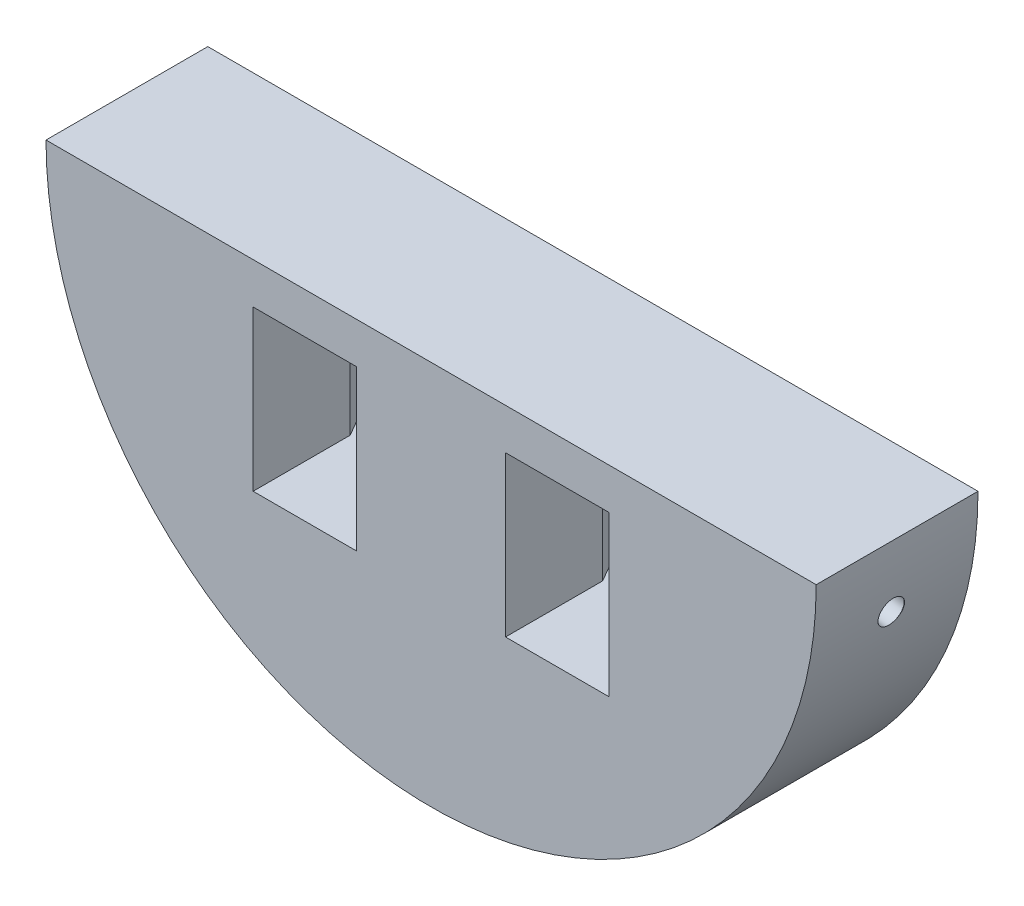
from build123d import *
from OCP.BRepFilletAPI import BRepFilletAPI_MakeChamfer

# Parameters (mm, degrees)
SKETCH1_W           = 16
SKETCH1_H           = 16
BOSS_EXTRUDE1_DEPTH = 25
CIRPATTERN1_COUNT   = 5
CIRPATTERN1_ANGLE   = 160
CHAMFER1_SIZE       = 15
CHAMFER1_SIZE2      = 8.660254038
CHAMFER2_SIZE       = 5.773502692
CHAMFER2_SIZE_2     = 10


with BuildPart() as part:
    # Sketch1 → Boss-Extrude1 (new body)
    with BuildSketch(Plane.XY):
        with BuildLine():
            Line((-119, 0), (0, 0))
            ThreePointArc((0, 0), (-59.5, -59.5), (-119, 0))
        make_face()
        with Locations((-40, -23)):
            Rectangle(SKETCH1_W, SKETCH1_H, mode=Mode.SUBTRACT)
        with Locations((-79, -23)):
            Rectangle(SKETCH1_W, SKETCH1_H, mode=Mode.SUBTRACT)
    extrude(amount=BOSS_EXTRUDE1_DEPTH)

    # Sketch4 → Ø4.0mm Dowel Hole2 (revolve, cut)
    with BuildSketch(Plane(origin=(-0.903938696, -10.332066571, 12.5), x_dir=(0.1736481776669305, 0.9848077530122081, 0), z_dir=(0, 0, 1))):
        Polygon((0, 0), (0, 11.201721238), (2, 10), (2, 0.025), (2.025, 0), align=None)
    f_4_0mm_dowel_hole2 = revolve(axis=Axis((5.349590536, -11.434732499, 12.5), (-0.9848077530122081, 0.1736481776669305, 0)), mode=Mode.SUBTRACT)

    # CirPattern1: Ø4.0mm Dowel Hole2 ×5 about axis
    cirpattern1_axis = Axis((-59.5, 0, 0), (0, 0, -1))
    for i in range(1, CIRPATTERN1_COUNT):
        add(f_4_0mm_dowel_hole2.rotate(cirpattern1_axis, i * CIRPATTERN1_ANGLE / (CIRPATTERN1_COUNT - 1)), mode=Mode.SUBTRACT)

    # Chamfer1: one chamfer whose edges measure the first distance from different faces: ONE call of the kernel's chamfer builder (chamfer() names one face for all edges)
    chamfer1_edges_1 = [part.edges().sort_by_distance(p)[0] for p in [
        (-40, -15, 25),
    ]]
    chamfer1_side_1 = [part.faces().sort_by_distance(p)[0] for p in [
        (-40, -15, 12.5),
    ]]
    chamfer1_edges_2 = [part.edges().sort_by_distance(p)[0] for p in [
        (-79, -15, 25),
    ]]
    chamfer1_side_2 = [part.faces().sort_by_distance(p)[0] for p in [
        (-79, -15, 12.5),
    ]]
    chamfer1 = BRepFilletAPI_MakeChamfer(part.part.solid().wrapped)
    for e in chamfer1_edges_1:
        chamfer1.Add(CHAMFER1_SIZE, CHAMFER1_SIZE2, e.wrapped, chamfer1_side_1[0].wrapped)  # the first distance lies on this face
    for e in chamfer1_edges_2:
        chamfer1.Add(CHAMFER1_SIZE, CHAMFER1_SIZE2, e.wrapped, chamfer1_side_2[0].wrapped)  # the first distance lies on this face
    add(Compound.cast(chamfer1.Shape()), mode=Mode.REPLACE)

    # Chamfer2
    chamfer2_edges_1 = [part.edges().sort_by_distance(p)[0] for p in [
        (-48, -23, 0),
    ]]
    chamfer2_side_1 = [part.faces().sort_by_distance(p)[0] for p in [
        (-48.115470054, -23, 0),
    ]]
    chamfer2_edges_2 = [part.edges().sort_by_distance(p)[0] for p in [
        (-40, -15, 0),
    ]]
    chamfer2_side_2 = [part.faces().sort_by_distance(p)[0] for p in [
        (-40, -14.884529946, 0),
    ]]
    chamfer2_edges_3 = [part.edges().sort_by_distance(p)[0] for p in [
        (-32, -23, 0),
    ]]
    chamfer2_side_3 = [part.faces().sort_by_distance(p)[0] for p in [
        (-31.884529946, -23, 0),
    ]]
    chamfer2_edges_4 = [part.edges().sort_by_distance(p)[0] for p in [
        (-87, -23, 0),
    ]]
    chamfer2_side_4 = [part.faces().sort_by_distance(p)[0] for p in [
        (-87, -23, 0.115470054),
    ]]
    chamfer2_edges_5 = [part.edges().sort_by_distance(p)[0] for p in [
        (-79, -15, 0),
    ]]
    chamfer2_side_5 = [part.faces().sort_by_distance(p)[0] for p in [
        (-79, -14.884529946, 0),
    ]]
    chamfer2_edges_6 = [part.edges().sort_by_distance(p)[0] for p in [
        (-71, -23, 0),
    ]]
    chamfer2_side_6 = [part.faces().sort_by_distance(p)[0] for p in [
        (-70.884529946, -23, 0),
    ]]
    chamfer2 = BRepFilletAPI_MakeChamfer(part.part.solid().wrapped)
    for e in chamfer2_edges_1:
        chamfer2.Add(CHAMFER2_SIZE - 0.0001, CHAMFER2_SIZE_2 - 0.0001, e.wrapped, chamfer2_side_1[0].wrapped)
    for e in chamfer2_edges_2:
        chamfer2.Add(CHAMFER2_SIZE - 0.0001, CHAMFER2_SIZE_2 - 0.0001, e.wrapped, chamfer2_side_2[0].wrapped)
    for e in chamfer2_edges_3:
        chamfer2.Add(CHAMFER2_SIZE - 0.0001, CHAMFER2_SIZE_2 - 0.0001, e.wrapped, chamfer2_side_3[0].wrapped)
    for e in chamfer2_edges_4:
        chamfer2.Add(CHAMFER2_SIZE_2 - 0.0001, CHAMFER2_SIZE - 0.0001, e.wrapped, chamfer2_side_4[0].wrapped)
    for e in chamfer2_edges_5:
        chamfer2.Add(CHAMFER2_SIZE - 0.0001, CHAMFER2_SIZE_2 - 0.0001, e.wrapped, chamfer2_side_5[0].wrapped)
    for e in chamfer2_edges_6:
        chamfer2.Add(CHAMFER2_SIZE - 0.0001, CHAMFER2_SIZE_2 - 0.0001, e.wrapped, chamfer2_side_6[0].wrapped)
    add(Compound.cast(chamfer2.Shape()), mode=Mode.REPLACE)  # a hair under: the kernel refuses the full size


solid = part.part
